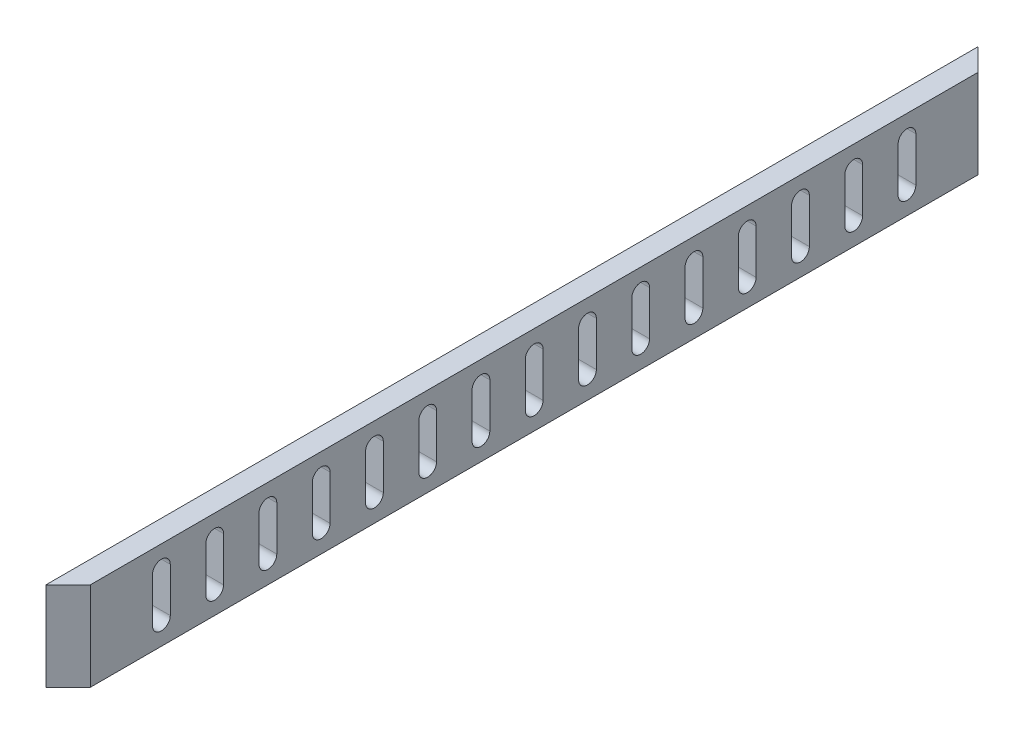
from build123d import *

# Parameters (mm, degrees)
ESQUISSE1_W                     = 10
ESQUISSE1_H                     = 40
BOSS_EXTRU_1_DEPTH              = 300
ENL_V_MAT_EXTRU_1_DEPTH         = 303.820078595
ENL_V_MAT_EXTRU_2_DEPTH         = 215.00934559
R_P_TITION_LIN_AIRE1_COUNT      = 8
R_P_TITION_LIN_AIRE1_PITCH      = 24
R_P_TITION_LIN_AIRE1_COUNT_DIR2 = 8
R_P_TITION_LIN_AIRE1_PITCH_DIR2 = 24


with BuildPart() as part:
    # Esquisse1 → Boss.-Extru.1 (new, symmetric)
    with BuildSketch(Plane.XY):
        with Locations((-5, 20)):
            Rectangle(ESQUISSE1_W, ESQUISSE1_H)
    extrude(amount=BOSS_EXTRU_1_DEPTH, both=True)

    # Esquisse2 → Enlèv. mat.-Extru.1 (cut, symmetric)
    with BuildSketch(Plane.XZ):
        Polygon((0, 200), (-10, 210), (-10, 300), (0, 300), align=None)
    enl_v_mat_extru_1 = extrude(amount=ENL_V_MAT_EXTRU_1_DEPTH, both=True, mode=Mode.SUBTRACT)

    # Symétrie1: Enlèv. mat.-Extru.1 across plane
    add(enl_v_mat_extru_1.mirror(Plane.XY), mode=Mode.SUBTRACT)

    # Esquisse3 → Enlèv. mat.-Extru.2 (cut, symmetric)
    with BuildSketch(Plane(origin=(0, 0, 0), x_dir=(0, 0, -1), z_dir=(1, 0, 0))):
        with BuildLine():
            Line((-4, 10), (-4, 30))
            ThreePointArc((-4, 30), (0, 34), (4, 30))
            Line((4, 30), (4, 10))
            ThreePointArc((4, 10), (0, 6), (-4, 10))
        make_face()
    enl_v_mat_extru_2 = extrude(amount=ENL_V_MAT_EXTRU_2_DEPTH, both=True, mode=Mode.SUBTRACT)

    # Répétition linéaire1: Enl_v. mat.-Extru.2 8 × 8
    with Locations(*[Vector(0, 0, 1) * (i * R_P_TITION_LIN_AIRE1_PITCH) + Vector(0, 0, -1) * (j * R_P_TITION_LIN_AIRE1_PITCH_DIR2) for i in range(R_P_TITION_LIN_AIRE1_COUNT) for j in range(R_P_TITION_LIN_AIRE1_COUNT_DIR2) if (i, j) != (0, 0)]):
        add(enl_v_mat_extru_2, mode=Mode.SUBTRACT)


solid = part.part
